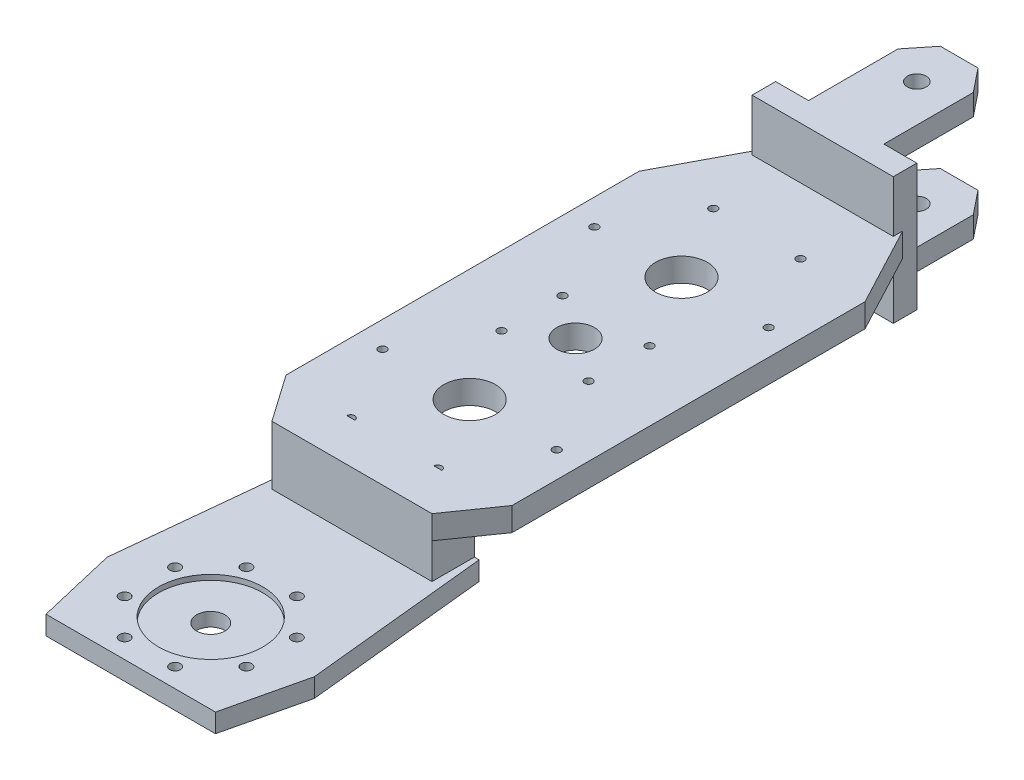
from build123d import *

# Parameters (mm, degrees)
SK_KNEE_PLATE_R         = 2.25
SK_KNEE_PLATE_R_2       = 6
KNEE_PLATE_DEPTH        = 8
SK_KNEE_PILOT_RECESS_R  = 22.15
KNEE_PILOT_RECESS_DEPTH = 2.2
SK_JOGGLE_W             = 68
SK_JOGGLE_H             = 33
JOGGLE_DEPTH            = 18
SK_WEB_R                = 1.7
SK_WEB_R_2              = 11
SK_WEB_R_3              = 8
WEB_DEPTH               = 10
SK_FORK_BAR_W           = 60
SK_FORK_BAR_H           = 54
FORK_BAR_DEPTH          = 10
SK_TINE_LAT_R           = 4
TINE_LAT_DEPTH          = 9
SK_TINE_MED_R           = 4
TINE_MED_DEPTH          = 9


with BuildPart() as part:
    # SK_Knee_Plate → Knee_Plate (new body)
    with BuildSketch(Plane(origin=(0, -28, 0), x_dir=(1, 0, 0), z_dir=(0, 1, 0))):
        Polygon((-36, -34), (36, -34), (44, 0), (36, 78), (-36, 78), (-44, 0), align=None)
        with Locations((25.86862691, 10.715136106)):
            Circle(SK_KNEE_PLATE_R, mode=Mode.SUBTRACT)
        with Locations((10.715136106, 25.86862691)):
            Circle(SK_KNEE_PLATE_R, mode=Mode.SUBTRACT)
        with Locations((-10.715136106, 25.86862691)):
            Circle(SK_KNEE_PLATE_R, mode=Mode.SUBTRACT)
        with Locations((-25.86862691, 10.715136106)):
            Circle(SK_KNEE_PLATE_R, mode=Mode.SUBTRACT)
        with Locations((-25.86862691, -10.715136106)):
            Circle(SK_KNEE_PLATE_R, mode=Mode.SUBTRACT)
        with Locations((-10.715136106, -25.86862691)):
            Circle(SK_KNEE_PLATE_R, mode=Mode.SUBTRACT)
        with Locations((10.715136106, -25.86862691)):
            Circle(SK_KNEE_PLATE_R, mode=Mode.SUBTRACT)
        with Locations((25.86862691, -10.715136106)):
            Circle(SK_KNEE_PLATE_R, mode=Mode.SUBTRACT)
        Circle(SK_KNEE_PLATE_R_2, mode=Mode.SUBTRACT)
    extrude(amount=KNEE_PLATE_DEPTH)

    # SK_Knee_Pilot_Recess → Knee_Pilot_Recess (cut)
    with BuildSketch(Plane(origin=(0, -20, 0), x_dir=(1, 0, 0), z_dir=(0, 1, 0))):
        Circle(SK_KNEE_PILOT_RECESS_R)
    extrude(amount=-KNEE_PILOT_RECESS_DEPTH, mode=Mode.SUBTRACT)

    # SK_Joggle → Joggle (add)
    with BuildSketch(Plane.XY.offset(-78)):
        with Locations((0, -11.5)):
            Rectangle(SK_JOGGLE_W, SK_JOGGLE_H)
    extrude(amount=JOGGLE_DEPTH)

    # SK_Web → Web (add)
    with BuildSketch(Plane(origin=(0, -5, 0), x_dir=(1, 0, 0), z_dir=(0, 1, 0))):
        Polygon((-34, 60), (34, 60), (48, 80), (48, 230), (30, 264), (-30, 264), (-48, 230), (-48, 80), align=None)
        with Locations((37, 110)):
            Circle(SK_WEB_R, mode=Mode.SUBTRACT)
        with Locations((18.5, 142.04293994)):
            Circle(SK_WEB_R, mode=Mode.SUBTRACT)
        with Locations((-18.5, 142.04293994)):
            Circle(SK_WEB_R, mode=Mode.SUBTRACT)
        with Locations((-37, 110)):
            Circle(SK_WEB_R, mode=Mode.SUBTRACT)
        with Locations((-18.5, 77.95706006)):
            Circle(SK_WEB_R, mode=Mode.SUBTRACT)
        with Locations((18.5, 77.95706006)):
            Circle(SK_WEB_R, mode=Mode.SUBTRACT)
        with Locations((37, 200)):
            Circle(SK_WEB_R, mode=Mode.SUBTRACT)
        with Locations((18.5, 232.04293994)):
            Circle(SK_WEB_R, mode=Mode.SUBTRACT)
        with Locations((-18.5, 232.04293994)):
            Circle(SK_WEB_R, mode=Mode.SUBTRACT)
        with Locations((-37, 200)):
            Circle(SK_WEB_R, mode=Mode.SUBTRACT)
        with Locations((-18.5, 167.95706006)):
            Circle(SK_WEB_R, mode=Mode.SUBTRACT)
        with Locations((18.5, 167.95706006)):
            Circle(SK_WEB_R, mode=Mode.SUBTRACT)
        with Locations((0, 110)):
            Circle(SK_WEB_R_2, mode=Mode.SUBTRACT)
        with Locations((0, 200)):
            Circle(SK_WEB_R_2, mode=Mode.SUBTRACT)
        with Locations((0, 155)):
            Circle(SK_WEB_R_3, mode=Mode.SUBTRACT)
    extrude(amount=WEB_DEPTH)

    # SK_Fork_Bar → Fork_Bar (add)
    with BuildSketch(Plane.XY.offset(-270)):
        Rectangle(SK_FORK_BAR_W, SK_FORK_BAR_H)
    extrude(amount=FORK_BAR_DEPTH)

    # SK_Tine_Lat → Tine_Lat (add)
    with BuildSketch(Plane(origin=(0, 18, 0), x_dir=(1, 0, 0), z_dir=(0, 1, 0))):
        Polygon((-16, 260), (16, 260), (16, 308), (8, 318), (-8, 318), (-16, 308), align=None)
        with Locations((0, 300)):
            Circle(SK_TINE_LAT_R, mode=Mode.SUBTRACT)
    extrude(amount=TINE_LAT_DEPTH)

    # SK_Tine_Med → Tine_Med (add)
    with BuildSketch(Plane(origin=(0, -27, 0), x_dir=(1, 0, 0), z_dir=(0, 1, 0))):
        Polygon((-16, 260), (16, 260), (16, 308), (8, 318), (-8, 318), (-16, 308), align=None)
        with Locations((0, 300)):
            Circle(SK_TINE_MED_R, mode=Mode.SUBTRACT)
    extrude(amount=TINE_MED_DEPTH)


solid = part.part
